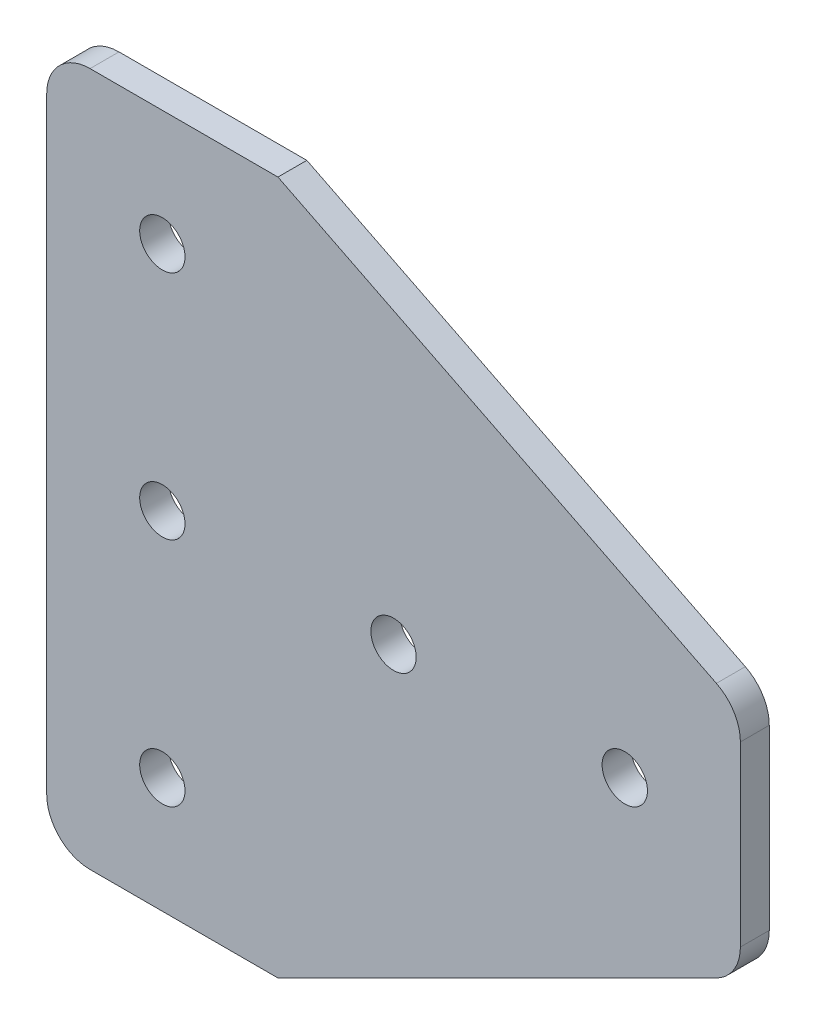
from build123d import *

# Parameters (mm, degrees)
SKETCH1_R           = 2.4892
BOSS_EXTRUDE1_DEPTH = 1.5875
FILLET1_R           = 4.7625


with BuildPart() as part:
    # Sketch1 → Boss-Extrude1 (new, symmetric)
    with BuildSketch(Plane.XY):
        Polygon((0, 0), (0, 76.2), (25.4, 76.2), (76.2, 50.8), (76.2, 25.4), (25.4, 0), align=None)
        with Locations((12.7, 63.5)):
            Circle(SKETCH1_R, mode=Mode.SUBTRACT)
        with Locations((12.7, 38.1)):
            Circle(SKETCH1_R, mode=Mode.SUBTRACT)
        with Locations((12.7, 12.7)):
            Circle(SKETCH1_R, mode=Mode.SUBTRACT)
        with Locations((38.1, 38.1)):
            Circle(SKETCH1_R, mode=Mode.SUBTRACT)
        with Locations((63.5, 38.1)):
            Circle(SKETCH1_R, mode=Mode.SUBTRACT)
    extrude(amount=BOSS_EXTRUDE1_DEPTH, both=True)

    # Fillet1
    fillet1_edges = [part.edges().sort_by_distance(p)[0] for p in [
        (0, 0, 0),
        (0, 76.2, 0),
        (76.2, 25.4, 0),
        (76.2, 50.8, 0),
    ]]
    fillet(fillet1_edges, radius=FILLET1_R)


solid = part.part
